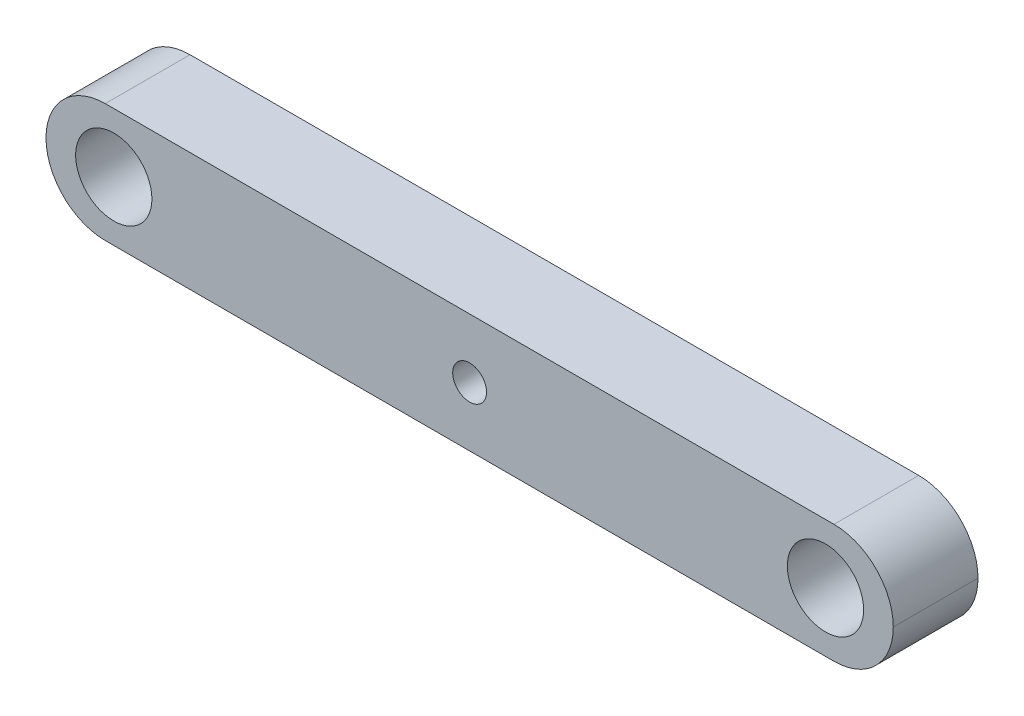
from build123d import *

# Parameters (mm, degrees)
ESBO_O1_W                = 50
ESBO_O1_H                = 7
ESBO_O1_R                = 1
ESBO_O1_R_2              = 2.25
RESSALTO_EXTRUS_O1_DEPTH = 5
FILETE1_R                = 3.5


with BuildPart() as part:
    # Esboço1 → Ressalto-extrusão1 (new body)
    with BuildSketch(Plane.XY):
        with Locations((25, 3.5)):
            Rectangle(ESBO_O1_W, ESBO_O1_H)
        with Locations((25, 3.5)):
            Circle(ESBO_O1_R, mode=Mode.SUBTRACT)
        with Locations((4, 3.5)):
            Circle(ESBO_O1_R_2, mode=Mode.SUBTRACT)
        with Locations((46, 3.5)):
            Circle(ESBO_O1_R_2, mode=Mode.SUBTRACT)
    extrude(amount=RESSALTO_EXTRUS_O1_DEPTH)

    # Filete1
    filete1_edges = [part.edges().sort_by_distance(p)[0] for p in [
        (50, 0, 2.5),
        (50, 7, 2.5),
        (0, 0, 2.5),
        (0, 7, 2.5),
    ]]
    fillet(filete1_edges, radius=FILETE1_R - 0.0001)  # a hair under: the kernel refuses the full size


solid = part.part
